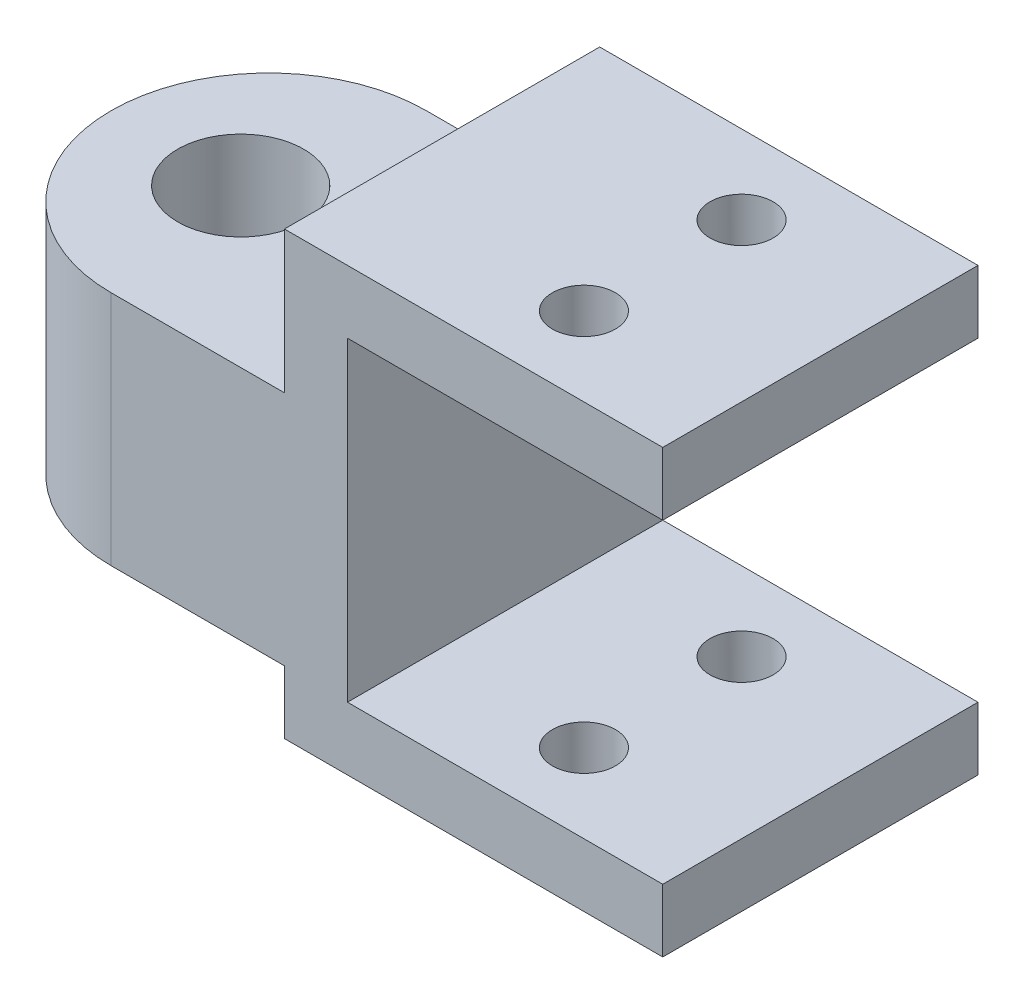
from build123d import *

# Parameters (mm, degrees)
SKETCH1_W               = 25
SKETCH1_H               = 15
SKETCH1_W_2             = 20
SKETCH1_H_2             = 4
BOSS_EXTRUDE1_DEPTH     = 20
SKETCH2_R               = 4
CUT_EXTRUDE2_DEPTH      = 45.56455991
CUT_EXTRUDE3_DEPTH      = 45.56455991
CUT_EXTRUDE3_DEPTH_BACK = 45.56455991
SKETCH3_R               = 2
FILLET4_R               = 10


with BuildPart() as part:
    # Sketch1 → Boss-Extrude1 (new body)
    with BuildSketch(Plane.XY):
        with Locations((-22.5, -2.5)):
            Rectangle(SKETCH1_W, SKETCH1_H)
        Polygon((-14, 14), (-14, 5), (-10, 5), (-10, 10), (-10, 14), align=None)
        with Locations((0, 12)):
            Rectangle(SKETCH1_W_2, SKETCH1_H_2)
        Polygon((-10, -10), (-14, -10), (-14, -14), (10, -14), (10, -10), align=None)
    extrude(amount=BOSS_EXTRUDE1_DEPTH)

    # Sketch2 → Cut-Extrude2 (cut, through all)
    with BuildSketch(Plane(origin=(0, 5, 0), x_dir=(1, 0, 0), z_dir=(0, 1, 0))):
        with Locations(Location((-26.775, -10, 0), (0, 0, 270))):
            Circle(SKETCH2_R)
    extrude(amount=-CUT_EXTRUDE2_DEPTH, mode=Mode.SUBTRACT)

    # Sketch3 → Cut-Extrude3 (cut, two sides: drawn at the far end of the back side and taken through both)
    with BuildSketch(Plane(origin=(0, 5, 0), x_dir=(1, 0, 0), z_dir=(0, 1, 0)).offset(-CUT_EXTRUDE3_DEPTH_BACK)):
        with Locations(Location((0, -5, 0), (0, 0, 270))):
            Circle(SKETCH3_R)
        with Locations(Location((0, -15, 0), (0, 0, 270))):
            Circle(SKETCH3_R)
    extrude(amount=CUT_EXTRUDE3_DEPTH + CUT_EXTRUDE3_DEPTH_BACK, mode=Mode.SUBTRACT)

    # Fillet4
    fillet4_edges = [part.edges().sort_by_distance(p)[0] for p in [
        (-35, -2.5, 0),
        (-35, -2.5, 20),
    ]]
    fillet(fillet4_edges, radius=FILLET4_R - 0.0001)  # a hair under: the kernel refuses the full size


solid = part.part
